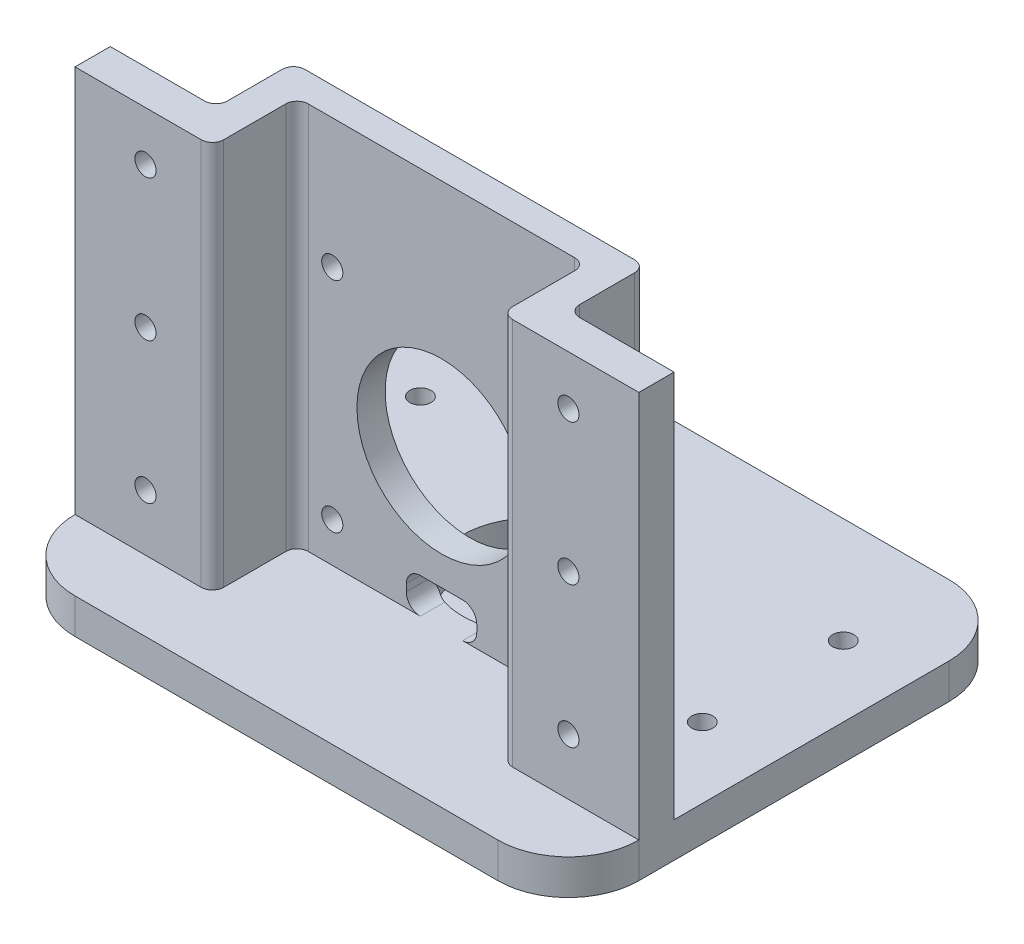
from build123d import *

# Parameters (mm, degrees)
SKETCH_1_W               = 80
SKETCH_1_H               = 70
SKETCH_1_R               = 10
EXTRUDE_1_DEPTH          = 5
EXTRUDE_2_DEPTH          = 55
CUT_EXTRUDE_1_DEPTH      = 60
CUT_EXTRUDE_1_DEPTH_BACK = 60
SKETCH_3_R               = 12
SKETCH_3_R_2             = 1.5
FILLET_3_R               = 1.6
SKETCH_4_R               = 1.5
CUT_EXTRUDE_2_DEPTH      = 10
SKETCH_5_W               = 80
SKETCH_5_H               = 6
CUT_EXTRUDE_3_DEPTH      = 10
FILLET_4_R               = 10
CUT_EXTRUDE_4_DEPTH      = 10
FILLET_5_R               = 2
SKETCH_8_W               = 50
SKETCH_8_H               = 45
SKETCH_8_R               = 3.5
SKETCH_8_R_2             = 1.5
EXTRUDE_3_DEPTH          = 3
FILLET_6_R               = 10
SKETCH_10_R              = 12
SKETCH_10_R_2            = 1.5
SKETCH_10_R_3            = 3.5
EXTRUDE_4_DEPTH          = 5
SKETCH_12_R              = 12
SKETCH_12_R_2            = 10.5
EXTRUDE_5_DEPTH          = 4
SKETCH_13_R              = 21
SKETCH_13_R_2            = 12
EXTRUDE_6_DEPTH          = 2


with BuildPart() as part:
    # 草图1 → 凸台-拉伸1 (new body)
    with BuildSketch(Plane(origin=(0, 0, 0), x_dir=(1, 0, 0), z_dir=(0, 1, 0))):
        Rectangle(SKETCH_1_W, SKETCH_1_H)
        with Locations(Location((0, 0, 0), (0, 0, 270))):
            Circle(SKETCH_1_R, mode=Mode.SUBTRACT)
    extrude(amount=EXTRUDE_1_DEPTH)

    # 草图2 → 凸台-拉伸2 (add)
    with BuildSketch(Plane(origin=(0, 5, 0), x_dir=(1, 0, 0), z_dir=(0, 1, 0))):
        Polygon((-25, -9), (25, -9), (25, -20), (40, -20), (40, -25), (20.5, -25), (20.5, -13), (-20.5, -13), (-20.5, -25), (-40, -25), (-40, -20), (-25, -20), align=None)
    extrude(amount=EXTRUDE_2_DEPTH)

    # 草图3 → 切除-拉伸1 (cut, two sides: drawn at the far end of the back side and taken through both)
    with BuildSketch(Plane.XY.offset(13).offset(-CUT_EXTRUDE_1_DEPTH_BACK)):
        with Locations((0, 26.15)):
            Circle(SKETCH_3_R)
        with Locations((15.5, 41.65)):
            Circle(SKETCH_3_R_2)
        with Locations((15.5, 10.65)):
            Circle(SKETCH_3_R_2)
        with Locations((-15.5, 10.65)):
            Circle(SKETCH_3_R_2)
        with Locations((-15.5, 41.65)):
            Circle(SKETCH_3_R_2)
        with Locations((-30, 13)):
            Circle(SKETCH_3_R_2)
        with Locations((-30, 33)):
            Circle(SKETCH_3_R_2)
        with Locations((-30, 53)):
            Circle(SKETCH_3_R_2)
        with Locations((30, 53)):
            Circle(SKETCH_3_R_2)
        with Locations((30, 33)):
            Circle(SKETCH_3_R_2)
        with Locations((30, 13)):
            Circle(SKETCH_3_R_2)
    extrude(amount=CUT_EXTRUDE_1_DEPTH + CUT_EXTRUDE_1_DEPTH_BACK, mode=Mode.SUBTRACT)

    # 圆角3
    fillet_3_edges = [part.edges().sort_by_distance(p)[0] for p in [
        (25, 32.5, 20),
        (25, 32.5, 9),
        (-25, 32.5, 9),
        (-25, 32.5, 20),
        (-20.5, 32.5, 25),
        (-20.5, 32.5, 13),
        (20.5, 32.5, 13),
        (20.5, 32.5, 25),
    ]]
    fillet(fillet_3_edges, radius=FILLET_3_R)

    # 草图4 → 切除-拉伸2 (cut)
    with BuildSketch(Plane(origin=(0, 5, 0), x_dir=(1, 0, 0), z_dir=(0, 1, 0))):
        with Locations(Location((30, 14, 0), (0, 0, 270))):
            Circle(SKETCH_4_R)
        with Locations(Location((30, -6, 0), (0, 0, 270))):
            Circle(SKETCH_4_R)
        with Locations(Location((-30, -6, 0), (0, 0, 90))):
            Circle(SKETCH_4_R)
        with Locations(Location((-30, 14, 0), (0, 0, 90))):
            Circle(SKETCH_4_R)
    extrude(amount=-CUT_EXTRUDE_2_DEPTH, mode=Mode.SUBTRACT)

    # 草图5 → 切除-拉伸3 (cut)
    with BuildSketch(Plane(origin=(0, 5, 0), x_dir=(1, 0, 0), z_dir=(0, 1, 0))):
        with Locations((0, 32)):
            Rectangle(SKETCH_5_W, SKETCH_5_H)
    extrude(amount=-CUT_EXTRUDE_3_DEPTH, mode=Mode.SUBTRACT)

    # 圆角4
    fillet_4_edges = [part.edges().sort_by_distance(p)[0] for p in [
        (-40, 2.5, -29),
        (40, 2.5, -29),
        (40, 2.5, 35),
        (-40, 2.5, 35),
    ]]
    fillet(fillet_4_edges, radius=FILLET_4_R)

    # 草图6 → 切除-拉伸4 (cut)
    with BuildSketch(Plane.XY.offset(13)):
        Polygon((0, 5), (5, 5), (5, 10), (-5, 10), (-5, 5), align=None)
    extrude(amount=-CUT_EXTRUDE_4_DEPTH, mode=Mode.SUBTRACT)

    # 圆角5
    # the kernel refuses this fillet: 2 mm, written as the material it adds along each edge
    with BuildSketch(Plane(origin=(-5, 5, 13), x_dir=(1, 0, 0), z_dir=(0, 0, -1))) as fillet_5_piece_1_section:
        with BuildLine():
            CenterArc((FILLET_5_R, -FILLET_5_R), FILLET_5_R, 90, 90)
            Line((0, -FILLET_5_R), (0, 0))
            Line((0, 0), (FILLET_5_R, 0))
        make_face()
    fillet_5_piece_1 = extrude(amount=4, mode=Mode.PRIVATE)
    fillet_5_piece_1 = fillet_5_piece_1 - Plane(origin=(0, 5.457543307, 0), x_dir=(0, 0, 1), z_dir=(0, -1, 0)) * Cylinder(10, 17, mode=Mode.PRIVATE)
    add(fillet_5_piece_1)
    with BuildSketch(Plane(origin=(-5, 10, 13), x_dir=(0, -1, 0), z_dir=(0, 0, -1)), Plane(origin=(5, 10, 13), x_dir=(-1, 0, 0), z_dir=(0, 0, -1))) as fillet_5_piece_2:
        with BuildLine():
            CenterArc((FILLET_5_R, -FILLET_5_R), FILLET_5_R, 90, 90)
            Line((0, -FILLET_5_R), (0, 0))
            Line((0, 0), (FILLET_5_R, 0))
        make_face()
    extrude(amount=4)
    with BuildSketch(Plane(origin=(5, 5, 13), x_dir=(-1, 0, 0), z_dir=(0, 0, -1))) as fillet_5_piece_3_section:
        with BuildLine():
            CenterArc((FILLET_5_R, FILLET_5_R), FILLET_5_R, 180, 90)
            Line((0, FILLET_5_R), (0, 0))
            Line((0, 0), (FILLET_5_R, 0))
        make_face()
    fillet_5_piece_3 = extrude(amount=4, mode=Mode.PRIVATE)
    fillet_5_piece_3 = fillet_5_piece_3 - Plane(origin=(0, 5.457543307, 0), x_dir=(0, 0, 1), z_dir=(0, -1, 0)) * Cylinder(10, 17, mode=Mode.PRIVATE)
    add(fillet_5_piece_3)

    # 草图8 → 凸台-拉伸3 (add)
    with BuildSketch(Plane.XZ):
        Rectangle(SKETCH_8_W, SKETCH_8_H)
        with Locations(Location((0, 0, 0), (0, 0, 270))):
            Circle(SKETCH_8_R, mode=Mode.SUBTRACT)
        with Locations(Location((0, 7, 0), (0, 0, 270))):
            Circle(SKETCH_8_R_2, mode=Mode.SUBTRACT)
        with Locations(Location((7, 0, 0), (0, 0, 270))):
            Circle(SKETCH_8_R_2, mode=Mode.SUBTRACT)
        with Locations(Location((-7, 0, 0), (0, 0, 90))):
            Circle(SKETCH_8_R_2, mode=Mode.SUBTRACT)
        with Locations(Location((0, -7, 0), (0, 0, 90))):
            Circle(SKETCH_8_R_2, mode=Mode.SUBTRACT)
    extrude(amount=EXTRUDE_3_DEPTH)

    # 圆角6
    fillet_6_edges = [part.edges().sort_by_distance(p)[0] for p in [
        (25, -1.5, -22.5),
        (25, -1.5, 22.5),
        (-25, -1.5, 22.5),
        (-25, -1.5, -22.5),
    ]]
    fillet(fillet_6_edges, radius=FILLET_6_R)

    # 草图10 → 凸台-拉伸4 (add)
    with BuildSketch(Plane.XZ.offset(3)):
        with Locations(Location((0, 0, 0), (0, 0, 270))):
            Circle(SKETCH_10_R)
        with Locations(Location((0, -7, 0), (0, 0, 90))):
            Circle(SKETCH_10_R_2, mode=Mode.SUBTRACT)
        with Locations(Location((-7, 0, 0), (0, 0, 90))):
            Circle(SKETCH_10_R_2, mode=Mode.SUBTRACT)
        with Locations(Location((7, 0, 0), (0, 0, 270))):
            Circle(SKETCH_10_R_2, mode=Mode.SUBTRACT)
        with Locations(Location((0, 0, 0), (0, 0, 270))):
            Circle(SKETCH_10_R_3, mode=Mode.SUBTRACT)
        with Locations(Location((0, 7, 0), (0, 0, 270))):
            Circle(SKETCH_10_R_2, mode=Mode.SUBTRACT)
    extrude(amount=EXTRUDE_4_DEPTH)

    # 草图12 → 凸台-拉伸5 (add)
    with BuildSketch(Plane.XZ.offset(8)):
        with Locations(Location((0, 0, 0), (0, 0, 270))):
            Circle(SKETCH_12_R)
        with Locations(Location((0, 0, 0), (0, 0, 270))):
            Circle(SKETCH_12_R_2, mode=Mode.SUBTRACT)
    extrude(amount=EXTRUDE_5_DEPTH)

    # 草图13 → 凸台-拉伸6 (add)
    with BuildSketch(Plane.XZ.offset(3)):
        with Locations(Location((0, 0, 0), (0, 0, 90))):
            Circle(SKETCH_13_R)
        with Locations(Location((0, 0, 0), (0, 0, 270))):
            Circle(SKETCH_13_R_2, mode=Mode.SUBTRACT)
    extrude(amount=EXTRUDE_6_DEPTH)


solid = part.part
